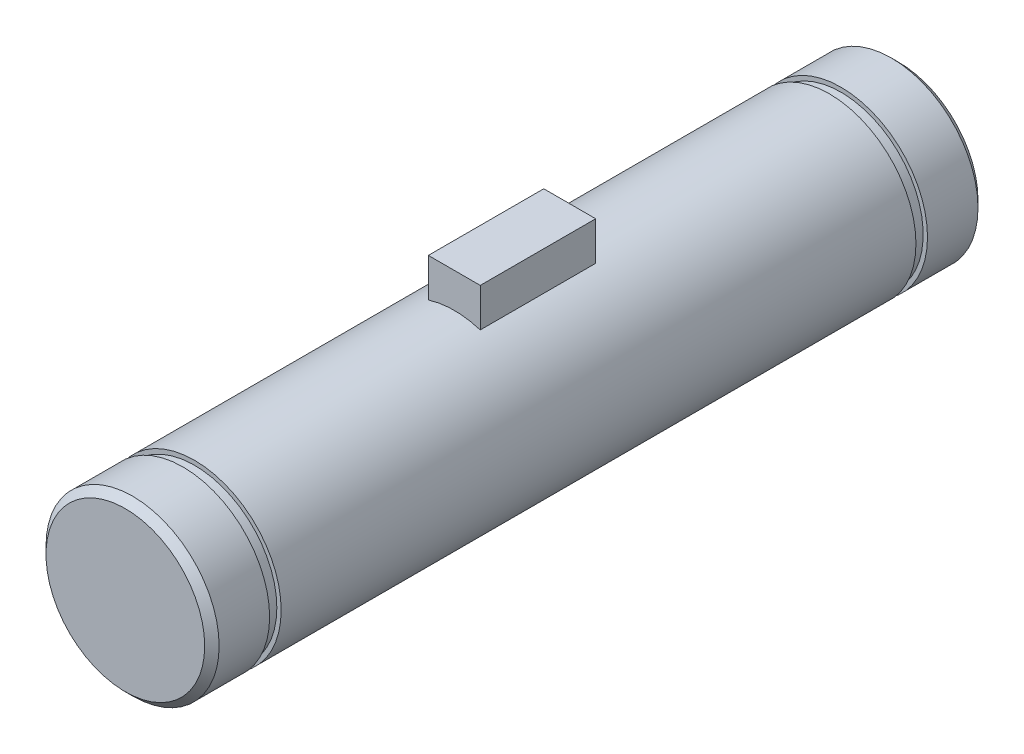
from build123d import *

# Parameters (mm, degrees)
SKETCH1_R           = 3
BOSS_EXTRUDE1_DEPTH = 26.8
BOSS_EXTRUDE2_START = -11.4
SKETCH2_W           = 1.8
SKETCH2_H           = 4.2
BOSS_EXTRUDE2_DEPTH = 4
CUT_EXTRUDE1_START  = -2
SKETCH3_R           = 3
SKETCH3_R_2         = 2.85
CUT_EXTRUDE1_DEPTH  = 0.4
CUT_EXTRUDE2_START  = -2.4
SKETCH4_R           = 3.000966843
SKETCH4_R_2         = 2.85
CUT_EXTRUDE2_DEPTH  = 0.4
CHAMFER1_SIZE       = 0.25


with BuildPart() as part:
    # Sketch1 → Boss-Extrude1 (new body)
    with BuildSketch(Plane.XY):
        Circle(SKETCH1_R)
    extrude(amount=BOSS_EXTRUDE1_DEPTH)

    # Sketch2 → Boss-Extrude2 (add)
    with BuildSketch(Plane(origin=(0, 0, 0), x_dir=(-1, 0, 0), z_dir=(0, 0, -1)).offset(BOSS_EXTRUDE2_START)):
        with Locations((0, 2.1)):
            Rectangle(SKETCH2_W, SKETCH2_H)
    extrude(amount=-BOSS_EXTRUDE2_DEPTH)

    # Sketch3 → Cut-Extrude1 (cut)
    with BuildSketch(Plane(origin=(0, 0, 0), x_dir=(-1, 0, 0), z_dir=(0, 0, -1)).offset(CUT_EXTRUDE1_START)):
        Circle(SKETCH3_R)
        Circle(SKETCH3_R_2, mode=Mode.SUBTRACT)
    extrude(amount=-CUT_EXTRUDE1_DEPTH, mode=Mode.SUBTRACT)

    # Sketch4 → Cut-Extrude2 (cut)
    with BuildSketch(Plane.XY.offset(26.8).offset(CUT_EXTRUDE2_START)):
        Circle(SKETCH4_R)
        Circle(SKETCH4_R_2, mode=Mode.SUBTRACT)
    extrude(amount=CUT_EXTRUDE2_DEPTH, mode=Mode.SUBTRACT)

    # Chamfer1
    chamfer1_edges = [part.edges().sort_by_distance(p)[0] for p in [
        (-3, 0, 0),
        (-3, 0, 26.8),
    ]]
    chamfer(chamfer1_edges, length=CHAMFER1_SIZE)


solid = part.part
